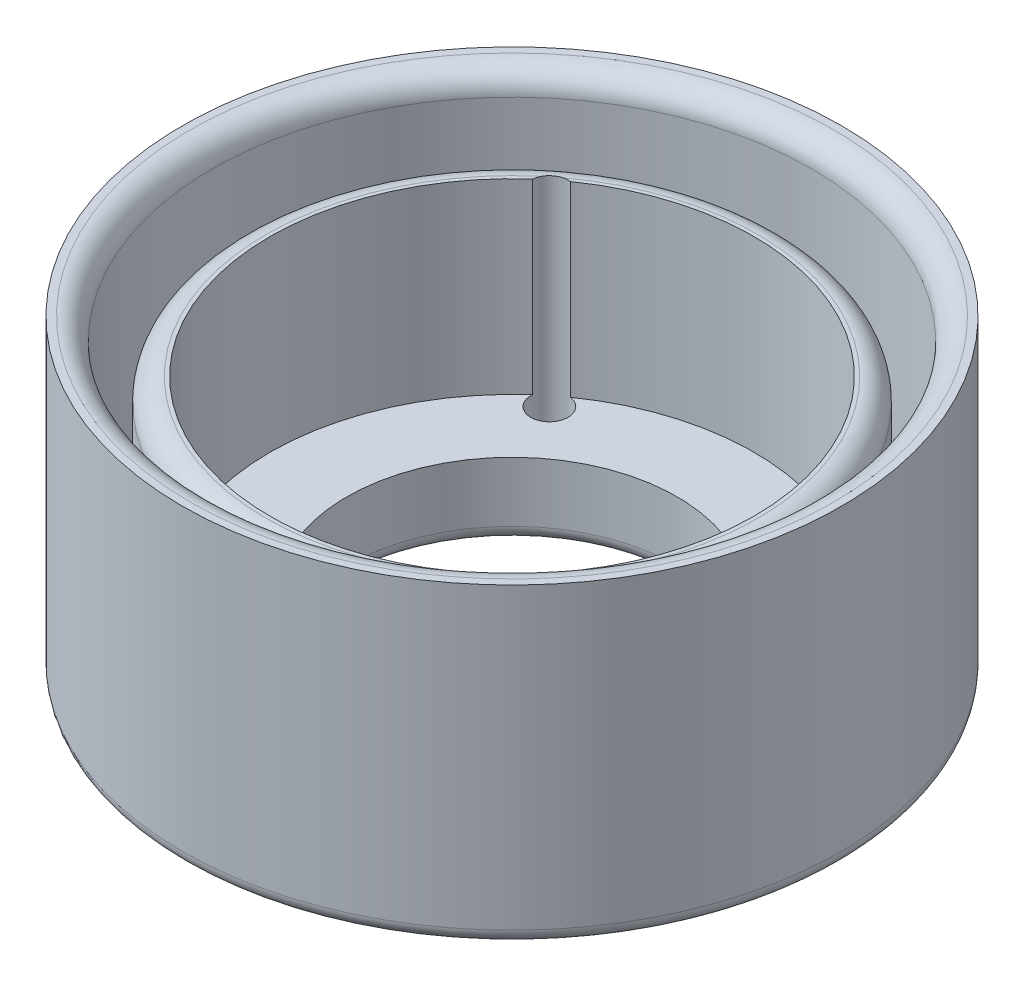
from build123d import *

# Parameters (mm, degrees)
CROQUIS1_R              = 22.05
CROQUIS1_R_2            = 20.05
SALIENTE_EXTRUIR1_DEPTH = 16
CROQUIS1_4_R            = 17.95
CROQUIS1_4_R_2          = 16.2
SALIENTE_EXTRUIR2_DEPTH = 12.5
SALIENTE_EXTRUIR4_START = -5
CROQUIS1_6_R            = 22.05
CROQUIS1_6_R_2          = 20.05
CROQUIS1_6_R_3          = 17.95
CROQUIS1_6_R_4          = 16.2
SALIENTE_EXTRUIR4_DEPTH = 5
CORTAR_EXTRUIR1_REACH   = 39.595
CROQUIS4_R              = 11.05
CROQUIS4_R_2            = 1.25
REDONDEO1_R             = 1
REDONDEO2_R             = 1.5
REDONDEO3_R             = 1


with BuildPart() as part:
    # Croquis1 → Saliente-Extruir1 (new body)
    with BuildSketch(Plane(origin=(0, 0, 0), x_dir=(1, 0, 0), z_dir=(0, 1, 0))):
        with Locations(Location((0, 0, 0), (0, 0, 270))):
            Circle(CROQUIS1_R)
        with Locations(Location((0, 0, 0), (0, 0, 270))):
            Circle(CROQUIS1_R_2, mode=Mode.SUBTRACT)
    extrude(amount=SALIENTE_EXTRUIR1_DEPTH)



with BuildPart() as body_2:
    # Croquis1<4> → Saliente-Extruir2 (new body)
    with BuildSketch(Plane(origin=(0, 0, 0), x_dir=(1, 0, 0), z_dir=(0, 1, 0))):
        with Locations(Location((0, 0, 0), (0, 0, 270))):
            Circle(CROQUIS1_4_R)
        with Locations(Location((0, 0, 0), (0, 0, 270))):
            Circle(CROQUIS1_4_R_2, mode=Mode.SUBTRACT)
    extrude(amount=SALIENTE_EXTRUIR2_DEPTH)


with BuildPart() as part_1:
    add(part.part)

    add(body_2.part)  # Saliente-Extruir4 merges body 2
    # Croquis1<6> → Saliente-Extruir4 (add)
    # profile 1 of 4: a face of its own
    with BuildSketch(Plane(origin=(0, 0, 0), x_dir=(1, 0, 0), z_dir=(0, 1, 0)).offset(SALIENTE_EXTRUIR4_START)):
        with Locations(Location((0, 0, 0), (0, 0, 270))):
            Circle(CROQUIS1_6_R)
        with Locations(Location((0, 0, 0), (0, 0, 270))):
            Circle(CROQUIS1_6_R_2, mode=Mode.SUBTRACT)
    # profile 2 of 4: a face of its own
    with BuildSketch(Plane(origin=(0, 0, 0), x_dir=(1, 0, 0), z_dir=(0, 1, 0)).offset(SALIENTE_EXTRUIR4_START)):
        with Locations(Location((0, 0, 0), (0, 0, 270))):
            Circle(CROQUIS1_6_R_2)
        with Locations(Location((0, 0, 0), (0, 0, 270))):
            Circle(CROQUIS1_6_R_3, mode=Mode.SUBTRACT)
    # profile 3 of 4: a face of its own
    with BuildSketch(Plane(origin=(0, 0, 0), x_dir=(1, 0, 0), z_dir=(0, 1, 0)).offset(SALIENTE_EXTRUIR4_START)):
        with Locations(Location((0, 0, 0), (0, 0, 270))):
            Circle(CROQUIS1_6_R_3)
        with Locations(Location((0, 0, 0), (0, 0, 270))):
            Circle(CROQUIS1_6_R_4, mode=Mode.SUBTRACT)
    # profile 4 of 4: a face of its own
    with BuildSketch(Plane(origin=(0, 0, 0), x_dir=(1, 0, 0), z_dir=(0, 1, 0)).offset(SALIENTE_EXTRUIR4_START)):
        with Locations(Location((0, 0, 0), (0, 0, 270))):
            Circle(CROQUIS1_6_R_4)
    extrude(amount=SALIENTE_EXTRUIR4_DEPTH)

    # Croquis4 → Cortar-Extruir1 (cut, up to next)
    with BuildSketch(Plane.XZ.offset(5), mode=Mode.PRIVATE) as cortar_extruir1_sk1:
        with Locations(Location((0, 0, 0), (0, 0, 270))):
            Circle(CROQUIS4_R)
    cortar_extruir1_tool1 = extrude(cortar_extruir1_sk1.sketch, amount=-CORTAR_EXTRUIR1_REACH, mode=Mode.PRIVATE) & part_1.part
    # Croquis4 → Cortar-Extruir1 (cut, up to next)
    with BuildSketch(Plane.XZ.offset(5), mode=Mode.PRIVATE) as cortar_extruir1_sk2:
        with Locations(Location((9.5, 12, 0), (0, 0, 270))):
            Circle(CROQUIS4_R_2)
    cortar_extruir1_tool2 = extrude(cortar_extruir1_sk2.sketch, amount=-CORTAR_EXTRUIR1_REACH, mode=Mode.PRIVATE) & part_1.part
    # Croquis4 → Cortar-Extruir1 (cut, up to next)
    with BuildSketch(Plane.XZ.offset(5), mode=Mode.PRIVATE) as cortar_extruir1_sk3:
        with Locations(Location((-9.5, -12, 0), (0, 0, 270))):
            Circle(CROQUIS4_R_2)
    cortar_extruir1_tool3 = extrude(cortar_extruir1_sk3.sketch, amount=-CORTAR_EXTRUIR1_REACH, mode=Mode.PRIVATE) & part_1.part
    add(cortar_extruir1_tool1.solids().sort_by_distance((0, -5, 0))[0], mode=Mode.SUBTRACT)
    add(cortar_extruir1_tool2.solids().sort_by_distance((9.5, -5, 12))[0], mode=Mode.SUBTRACT)
    add(cortar_extruir1_tool3.solids().sort_by_distance((-9.5, -5, -12))[0], mode=Mode.SUBTRACT)

    # Redondeo1
    redondeo1_edges = [part_1.edges().sort_by_distance(p)[0] for p in [
        (0, -5, 11.05),
    ]]
    fillet(redondeo1_edges, radius=REDONDEO1_R)

    # Redondeo2
    # the kernel refuses this fillet: 1.5 mm, written as the material it takes off along each edge
    with BuildSketch(Plane(origin=(0, 12.5, 0), x_dir=(0, 0, 1), z_dir=(-1, 0, 0))) as redondeo2_piece_1:
        with BuildLine():
            CenterArc((17.95 - REDONDEO2_R, -REDONDEO2_R), REDONDEO2_R, 0, 90)
            Line((17.95, -REDONDEO2_R), (17.95, 0))
            Line((17.95, 0), (17.95 - REDONDEO2_R, 0))
        make_face()
    revolve(axis=Axis((0, 12.5, 0), (0, 1, 0)), mode=Mode.SUBTRACT)
    with BuildSketch(Plane(origin=(0, 16, 0), x_dir=(0, 0, 1), z_dir=(-1, 0, 0))) as redondeo2_piece_2:
        with BuildLine():
            CenterArc((20.05 + REDONDEO2_R, -REDONDEO2_R), REDONDEO2_R, 90, 90)
            Line((20.05, -REDONDEO2_R), (20.05, 0))
            Line((20.05, 0), (20.05 + REDONDEO2_R, 0))
        make_face()
    revolve(axis=Axis((0, 16, 0), (0, 1, 0)), mode=Mode.SUBTRACT)

    # Redondeo3
    redondeo3_edges = [part_1.edges().sort_by_distance(p)[0] for p in [
        (0, -5, -22.05),
    ]]
    fillet(redondeo3_edges, radius=REDONDEO3_R)


solid = part_1.part
